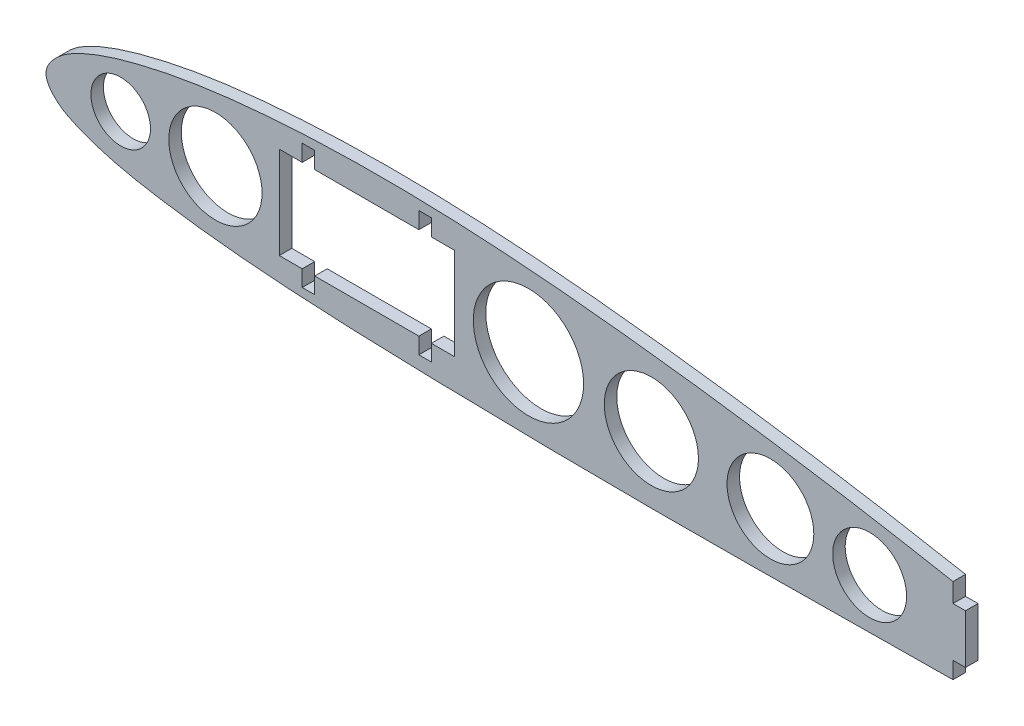
from build123d import *

# Parameters (mm, degrees)
STOCK_WING_STRUCTURESIZING_1_START = 350.5
STOCK_WING_STRUCTURESIZING_1_DEPTH = 3
CUT_EXTRUDE5_DEPTH                 = 278.894871602
CUT_EXTRUDE5_DEPTH_BACK            = 278.894871602
SKETCH6_W                          = 70.018254377
SKETCH6_H                          = 51.935461956
CUT_EXTRUDE10_DEPTH                = 3
SKETCH8_R                          = 7.148862164
SKETCH8_R_2                        = 11.194748363
SKETCH8_R_3                        = 13.238139548
SKETCH8_R_4                        = 11.300732785
SKETCH8_R_5                        = 10.413661788
SKETCH8_R_6                        = 8.870161498
CUT_EXTRUDE11_DEPTH                = 10
SKETCH9_W                          = 4.568985155
SKETCH9_H                          = 8.957608769
SKETCH9_W_2                        = 5.601046355
SKETCH9_H_2                        = 7.032198149
CUT_EXTRUDE12_DEPTH                = 10


# Read off the part's stored shape, not the designer's step: Stock-Wing_structureSizing-1
with BuildPart() as part:
    # Stock-Wing_structureSizing-1 outline → Stock-Wing_structureSizing-1 (new body)
    with BuildSketch(Plane.XY.offset(STOCK_WING_STRUCTURESIZING_1_START)):
        with BuildLine():
            Line((276.744987748, -9.975467242), (276.744987748, -2.791972149))
            add(Edge.make_bspline(
                [(276.744987748, -2.791972149), (265.3857023, -0.102525952), (253.985388892, 2.407220527), (231.123115134, 7.137179769), (219.66894224, 9.35664169), (202.450532833, 12.449607831), (196.704666185, 13.440005467), (185.197495984, 15.322846112), (179.436018194, 16.214183509), (167.896810084, 17.893728146), (162.119320772, 18.683464695), (150.549559093, 20.169132171), (144.757676972, 20.867539393), (133.154760401, 22.142823058), (127.340720117, 22.719276226), (115.726117513, 23.709424358), (109.921864102, 24.123286294), (92.520744809, 25.054695045), (80.935765142, 25.255529424), (63.589579679, 24.723206588), (57.812696472, 24.40777964), (49.15741104, 23.667136334), (46.27396258, 23.376378774), (40.511150261, 22.68602794), (37.631848569, 22.284778258), (31.878918329, 21.331115885), (29.005409213, 20.775520933), (24.699904445, 19.815325722), (23.265457389, 19.476044022), (20.398415094, 18.74813831), (18.963740816, 18.357002163), (16.106748162, 17.497000764), (14.692710081, 17.03099603), (11.902486035, 16.004726933), (10.526189891, 15.444736939), (8.50012674, 14.509175123), (7.830361802, 14.183402304), (6.512563898, 13.477739544), (5.865248411, 13.093583044), (4.633392785, 12.255605476), (4.045066641, 11.801499914), (3.209118512, 11.061128735), (2.938431583, 10.804207958), (2.416562808, 10.265550671), (2.165207772, 9.983507914), (1.696102707, 9.397220013), (1.477442994, 9.09171798), (1.085439515, 8.447078561), (0.915512906, 8.113897404), (0.714798114, 7.59155933), (0.657190766, 7.413573783), (0.566275814, 7.047480769), (0.533643429, 6.859526942), (0.498702003, 6.485823786), (0.495732967, 6.298500114), (0.52230969, 5.922794269), (0.553180601, 5.733657444), (0.641956646, 5.367254731), (0.699629973, 5.188174612), (0.835770495, 4.836464845), (0.914681224, 4.663114785), (1.173802922, 4.160517642), (1.376431151, 3.845824341), (1.822835658, 3.244491079), (2.068245893, 2.956719217), (2.585349641, 2.410512622), (2.856205808, 2.152934366), (3.699269455, 1.418677094), (4.302923323, 0.981675809), (5.262649419, 0.394618321), (5.591648375, 0.21018796), (6.254696782, -0.135942129), (6.589931521, -0.298692503), (7.602521133, -0.767803382), (8.28593821, -1.057311971), (9.662885491, -1.60821635), (10.357226689, -1.867357708), (12.455074514, -2.603572901), (13.873250521, -3.039868309), (16.739197416, -3.830190303), (18.188973825, -4.184254143), (22.54237297, -5.143962802), (25.459339583, -5.655261329), (31.306270814, -6.564233952), (34.235701619, -6.966574468), (40.104165427, -7.687316125), (43.043386977, -8.004069053), (51.874086741, -8.840379009), (57.778366073, -9.248032718), (66.64804678, -9.743583642), (69.60756187, -9.887823594), (75.525585547, -10.141245843), (78.484610817, -10.250077692), (84.402679828, -10.443151081), (87.361723417, -10.527595381), (93.279819329, -10.684856962), (96.238871496, -10.7578835), (111.034153794, -11.094438823), (122.870449548, -11.270610432), (140.625005024, -11.385979432), (146.54320834, -11.400264082), (158.379650661, -11.381324799), (164.297889136, -11.348805922), (176.134384089, -11.259801078), (182.052639742, -11.204415721), (193.889154401, -11.089178887), (199.807414258, -11.02819544), (217.562198328, -10.839257795), (229.398721047, -10.713290888), (253.0718283, -10.379069852), (264.908412973, -10.164021277), (276.744987748, -9.975467242)],
                knots=[0, 0, 0, 0, 0.0625, 0.0625, 0.125, 0.125, 0.15625, 0.15625, 0.1875, 0.1875, 0.21875, 0.21875, 0.25, 0.25, 0.28125, 0.28125, 0.3125, 0.3125, 0.375, 0.375, 0.40625, 0.40625, 0.421875, 0.421875, 0.4375, 0.4375, 0.453125, 0.453125, 0.4609375, 0.4609375, 0.46875, 0.46875, 0.4765625, 0.4765625, 0.484375, 0.484375, 0.48828125, 0.48828125, 0.4921875, 0.4921875, 0.49609375, 0.49609375, 0.498046875, 0.498046875, 0.5, 0.5, 0.501953125, 0.501953125, 0.50390625, 0.50390625, 0.504882813, 0.504882813, 0.505859375, 0.505859375, 0.506835938, 0.506835938, 0.5078125, 0.5078125, 0.508789063, 0.508789063, 0.509765625, 0.509765625, 0.51171875, 0.51171875, 0.513671875, 0.513671875, 0.515625, 0.515625, 0.51953125, 0.51953125, 0.521484375, 0.521484375, 0.5234375, 0.5234375, 0.52734375, 0.52734375, 0.53125, 0.53125, 0.5390625, 0.5390625, 0.546875, 0.546875, 0.5625, 0.5625, 0.578125, 0.578125, 0.59375, 0.59375, 0.625, 0.625, 0.640625, 0.640625, 0.65625, 0.65625, 0.671875, 0.671875, 0.6875, 0.6875, 0.75, 0.75, 0.78125, 0.78125, 0.8125, 0.8125, 0.84375, 0.84375, 0.875, 0.875, 0.9375, 0.9375, 1, 1, 1, 1], degree=3))
        make_face()
    extrude(amount=STOCK_WING_STRUCTURESIZING_1_DEPTH)

    # Sketch6 → Cut-Extrude5 (cut, two sides: drawn at the far end of the back side and taken through both)
    with BuildSketch(Plane.XY.offset(353.5).offset(-CUT_EXTRUDE5_DEPTH_BACK)):
        with Locations((256.209127189, -10.885700148)):
            Rectangle(SKETCH6_W, SKETCH6_H)
    extrude(amount=CUT_EXTRUDE5_DEPTH + CUT_EXTRUDE5_DEPTH_BACK, mode=Mode.SUBTRACT)

    # Sketch3 → Cut-Extrude10 (cut)
    with BuildSketch(Plane.XY.offset(353.5)):
        Polygon((62, 22.604923241), (65, 22.604923241), (65, 18.604923241), (90, 18.604923241), (90, 22.604923241), (93, 22.604923241), (93, 18.604923241), (98.5, 18.604923241), (98.5, -3.505076759), (93, -3.505076759), (93, -7.395076759), (90, -7.395076759), (90, -3.505076759), (65, -3.505076759), (65, -7.395076759), (62, -7.395076759), (62, -3.505076759), (56.5, -3.505076759), (56.5, 18.604923241), (62, 18.604923241), align=None)
    extrude(amount=-CUT_EXTRUDE10_DEPTH, mode=Mode.SUBTRACT)

    # Sketch8 → Cut-Extrude11 (cut)
    with BuildSketch(Plane.XY.offset(353.5)):
        with Locations((18.431457036, 7.38733134)):
            Circle(SKETCH8_R)
        with Locations((41.170369438, 7.38733134)):
            Circle(SKETCH8_R_2)
        with Locations((116.300965144, 6.31184224)):
            Circle(SKETCH8_R_3)
        with Locations((145.800094747, 4.621787939)):
            Circle(SKETCH8_R_4)
        with Locations((174.377376549, 2.778092339)):
            Circle(SKETCH8_R_5)
        with Locations((198.191778052, 0.934396739)):
            Circle(SKETCH8_R_6)
    extrude(amount=-CUT_EXTRUDE11_DEPTH, mode=Mode.SUBTRACT)

    # Sketch9 → Cut-Extrude12 (cut)
    with BuildSketch(Plane.XY.offset(353.5)):
        with Locations((220.484494298, 9.486664666)):
            Rectangle(SKETCH9_W, SKETCH9_H)
        with Locations((221.000524898, -10.308238794)):
            Rectangle(SKETCH9_W_2, SKETCH9_H_2)
    extrude(amount=-CUT_EXTRUDE12_DEPTH, mode=Mode.SUBTRACT)


solid = part.part
